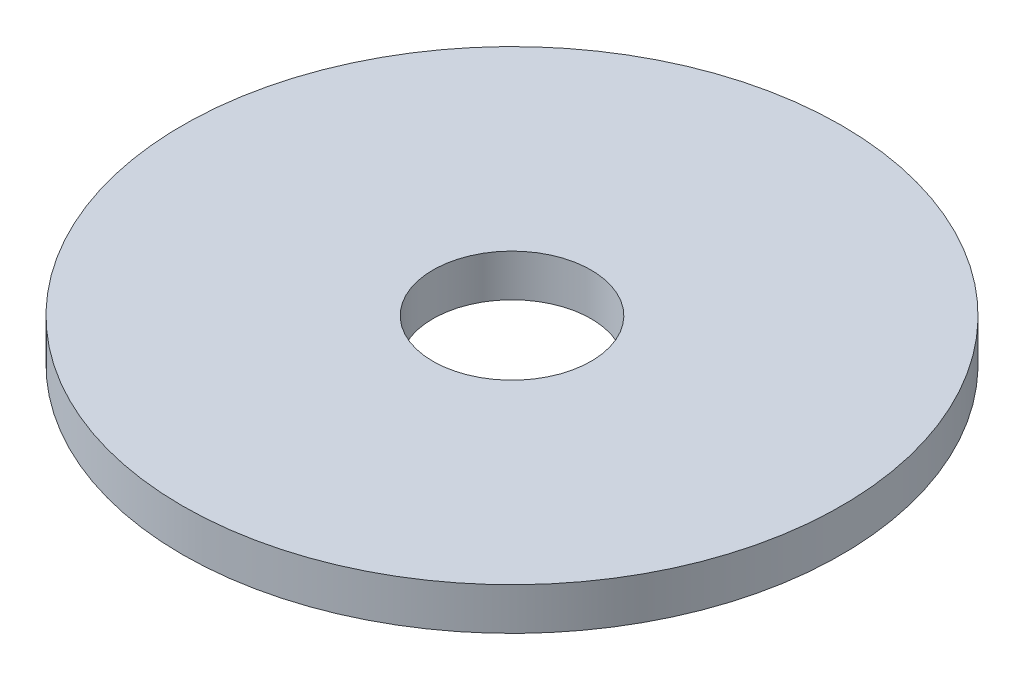
from build123d import *

# Parameters (mm, degrees)
SKETCH1_R           = 12.5
SKETCH1_R_2         = 3
BOSS_EXTRUDE1_DEPTH = 1.6


with BuildPart() as part:
    # Sketch1 → Boss-Extrude1 (new body)
    with BuildSketch(Plane(origin=(0, 0, 0), x_dir=(1, 0, 0), z_dir=(0, 1, 0))):
        Circle(SKETCH1_R)
        Circle(SKETCH1_R_2, mode=Mode.SUBTRACT)
    extrude(amount=BOSS_EXTRUDE1_DEPTH)


solid = part.part
